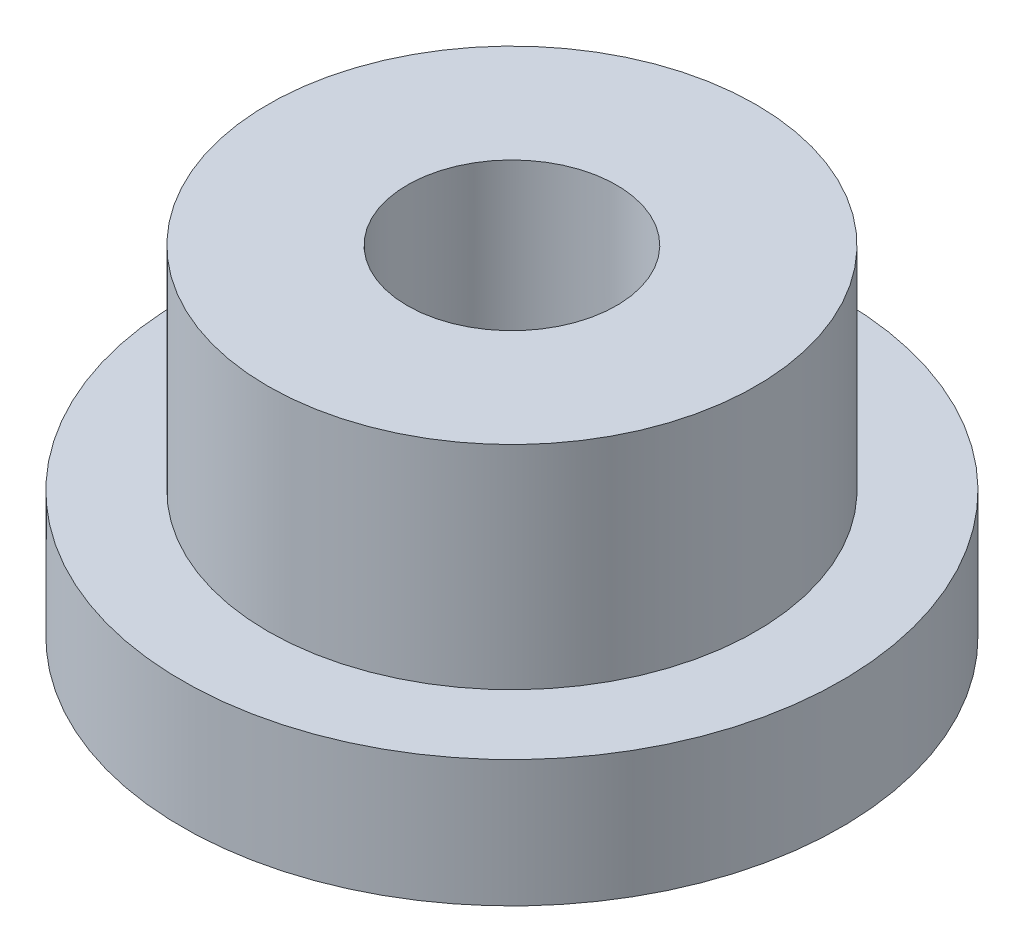
from build123d import *

# Parameters (mm, degrees)
SKETCH_2_R      = 3.85
SKETCH_2_R_2    = 1.65
EXTRUDE_8_DEPTH = 3.35
SKETCH_3_R      = 5.2
EXTRUDE_9_DEPTH = 2


with BuildPart() as part:
    # 草图2 → 凸台-拉伸8 (new body)
    with BuildSketch(Plane(origin=(0, 0, 0), x_dir=(1, 0, 0), z_dir=(0, 1, 0))):
        with Locations(Location((0, 0, 0), (0, 0, 270))):
            Circle(SKETCH_2_R)
        with Locations(Location((0, 0, 0), (0, 0, 270))):
            Circle(SKETCH_2_R_2, mode=Mode.SUBTRACT)
    extrude(amount=-EXTRUDE_8_DEPTH)

    # 草图3 → 凸台-拉伸9 (add)
    with BuildSketch(Plane(origin=(0, -3.35, 0), x_dir=(-1, 0, 0), z_dir=(0, -1, 0))):
        with Locations(Location((0, 0, 0), (0, 0, 90))):
            Circle(SKETCH_3_R)
    extrude(amount=EXTRUDE_9_DEPTH)

    # 切除-放样1: read off the stored shape, not the designer's step
    # 切除-放样1: loft between two sections, ruled curve by curve
    loft_1_from = [
        Edge.make_bspline([(0.764858596, -5.35, -3.56896222), (-6.373065844, -5.35, -5.098679412), (-7.902783036, -5.35, 2.039245028), (-0.764858596, -5.35, 3.56896222), (6.373065844, -5.35, 5.098679412), (7.902783036, -5.35, -2.039245028), (0.764858596, -5.35, -3.56896222)], [0, 0, 0, 0, 0.5, 0.5, 0.5, 1, 1, 1, 1], 3, [1, 0.333333333, 0.333333333, 1, 0.333333333, 0.333333333, 1]),
    ]
    loft_1_to = [
        Edge.make_bspline([(-0.535444465, -3.35, -1.56070472), (-3.656853906, -3.35, -0.48981579), (-2.585964976, -3.35, 2.631593651), (0.535444465, -3.35, 1.56070472), (3.656853906, -3.35, 0.48981579), (2.585964976, -3.35, -2.631593651), (-0.535444465, -3.35, -1.56070472)], [0, 0, 0, 0, 0.5, 0.5, 0.5, 1, 1, 1, 1], 3, [1, 0.333333333, 0.333333333, 1, 0.333333333, 0.333333333, 1]),
    ]
    loft_1 = Solid(Shell([*[Face.make_surface_from_curves(loft_1_from[k], loft_1_to[k]) for k in range(1)], Face(Wire(loft_1_from)), Face(Wire(loft_1_to))]))
    add(loft_1, mode=Mode.SUBTRACT)


solid = part.part
